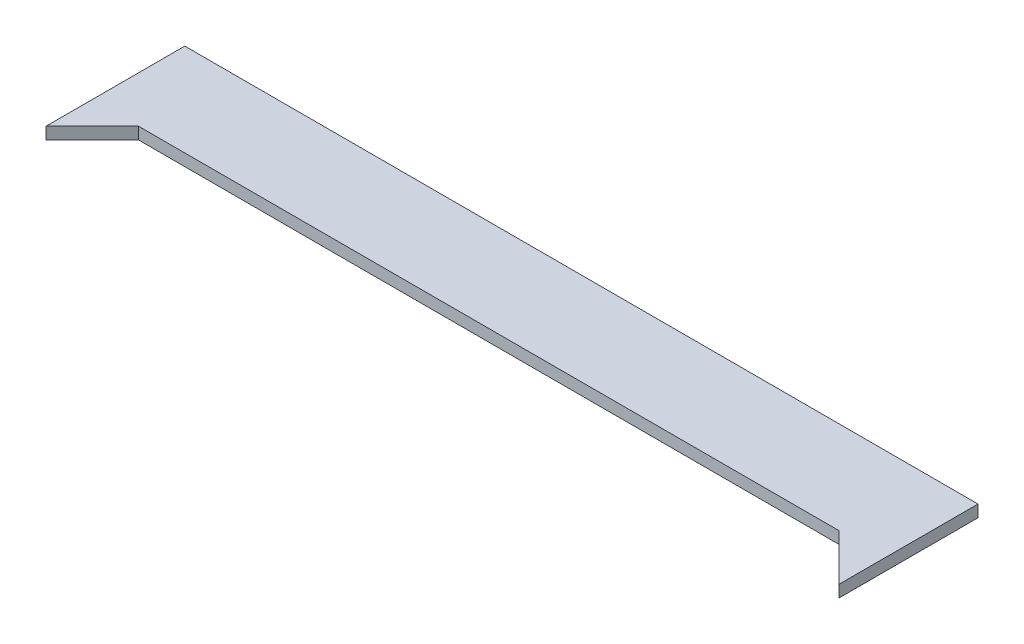
from build123d import *

# Parameters (mm, degrees)
BOSS_EXTRUDE1_DEPTH = 6


with BuildPart() as part:
    # Sketch1 → Boss-Extrude1 (new body)
    with BuildSketch(Plane(origin=(0, 0, 0), x_dir=(1, 0, 0), z_dir=(0, 1, 0))):
        Polygon((-200, 0), (-200, 70), (200, 70), (200, 0), (176.67, 23.33), (-176.67, 23.33), align=None)
    extrude(amount=BOSS_EXTRUDE1_DEPTH)


solid = part.part
